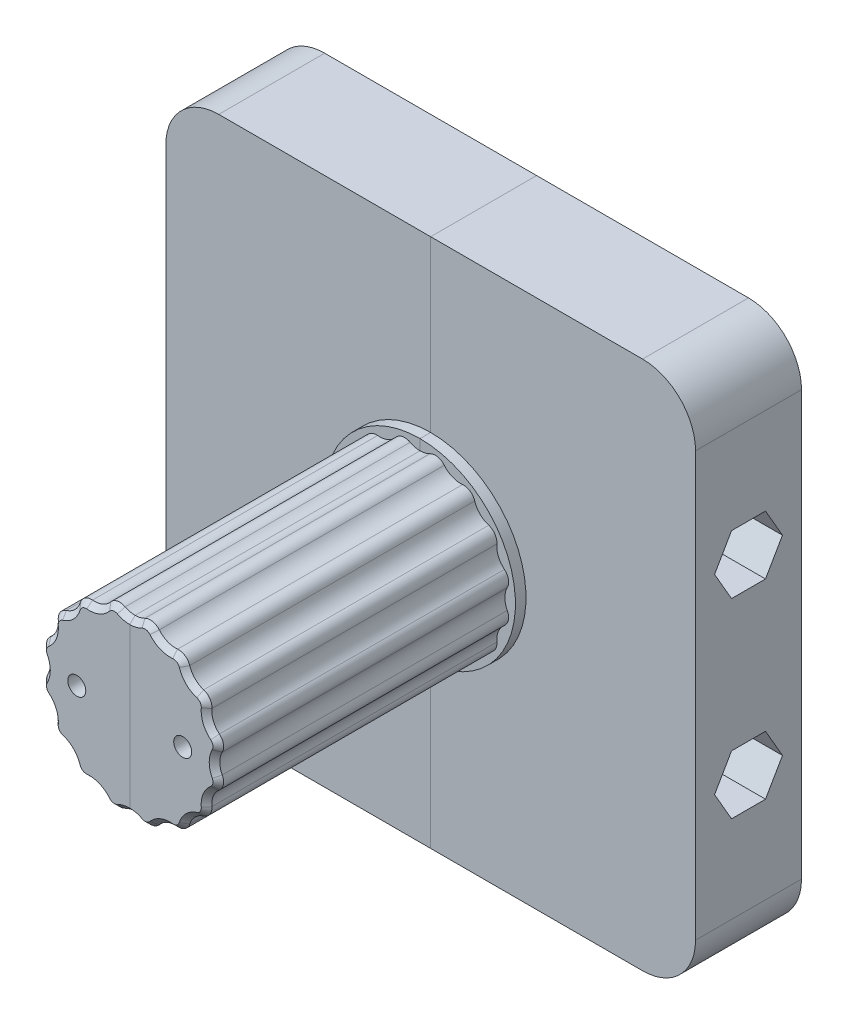
from build123d import *

# Parameters (mm, degrees)
ESQUISSE1_W                           = 50
ESQUISSE1_H                           = 50
BOSS_EXTRU_1_DEPTH                    = 10
ESQUISSE2_R                           = 9
BOSS_EXTRU_2_DEPTH                    = 1
BOSS_EXTRU_3_START                    = 1
ESQUISSE5_R                           = 8.5
BOSS_EXTRU_3_DEPTH                    = 27.4
ESQUISSE16_R                          = 0.85
ENL_V_MAT_EXTRU_9_DEPTH               = 10
ESQUISSE7_R                           = 9.904031252
ENL_V_MAT_EXTRU_2_DEPTH               = 27.4
CHANFREIN1_SIZE                       = 0.5
CONG_1_R                              = 5
ESQUISSE10_R                          = 2.15
ENL_V_MAT_EXTRU_5_DEPTH               = 8
CHANFREIN3_SIZE                       = 1.5
ENL_VEMENT_DE_MATI_RE_BALAYAGE1_PITCH = 1.27
ENL_VEMENT_DE_MATI_RE_BALAYAGE1_TO    = 8
ESQUISSE11_R                          = 2.25
ENL_V_MAT_EXTRU_6_DEPTH               = 5
CHANFREIN2_SIZE                       = 2
CHANFREIN4_SIZE                       = 1
CUT_EXTRUDE3_DEPTH                    = 1
SKETCH5_R                             = 0.9
CUT_EXTRUDE4_DEPTH                    = 3.5
SKETCH5_4_R                           = 1.6
CUT_EXTRUDE6_DEPTH                    = 10
CUT_EXTRUDE7_START                    = -10
SKETCH5_6_R                           = 3
CUT_EXTRUDE7_DEPTH                    = 43.197317939
CUT_EXTRUDE8_START                    = 10
CUT_EXTRUDE8_DEPTH                    = 43.197317939


with BuildPart() as part:
    # Esquisse1 → Boss.-Extru.1 (new body)
    with BuildSketch(Plane.XY):
        Rectangle(ESQUISSE1_W, ESQUISSE1_H)
    extrude(amount=BOSS_EXTRU_1_DEPTH)

    # Esquisse2 → Boss.-Extru.2 (add)
    with BuildSketch(Plane.XY.offset(10)):
        Circle(ESQUISSE2_R)
    extrude(amount=BOSS_EXTRU_2_DEPTH)

    # Esquisse5 → Boss.-Extru.3 (add)
    with BuildSketch(Plane.XY.offset(10).offset(BOSS_EXTRU_3_START)):
        Circle(ESQUISSE5_R)
    extrude(amount=BOSS_EXTRU_3_DEPTH)

    # Esquisse16 → Enlèv. mat.-Extru.9 (cut)
    with BuildSketch(Plane.XY.offset(38.4)):
        with Locations((-5, 0)):
            Circle(ESQUISSE16_R)
        with Locations((5, 0)):
            Circle(ESQUISSE16_R)
    extrude(amount=-ENL_V_MAT_EXTRU_9_DEPTH, mode=Mode.SUBTRACT)

    # Esquisse7 → Enlèv. mat.-Extru.2 (cut)
    with BuildSketch(Plane.XY.offset(38.4)):
        Circle(ESQUISSE7_R)
        with BuildLine():
            ThreePointArc((-0.933317751, 8.231125223), (0, 8), (0.933317751, 8.231125223))
            ThreePointArc((0.933317751, 8.231125223), (1.658267737, 8.336674883), (2.287642085, 7.961733364))
            ThreePointArc((2.287642085, 7.961733364), (3.061467459, 7.39103626), (4.01218842, 7.247402883))
            ThreePointArc((4.01218842, 7.247402883), (4.722346981, 7.067491705), (5.160329152, 6.480239773))
            ThreePointArc((5.160329152, 6.480239773), (5.656854249, 5.656854249), (6.480239773, 5.160329152))
            ThreePointArc((6.480239773, 5.160329152), (7.067491705, 4.722346981), (7.247402883, 4.01218842))
            ThreePointArc((7.247402883, 4.01218842), (7.39103626, 3.061467459), (7.961733364, 2.287642085))
            ThreePointArc((7.961733364, 2.287642085), (8.336674883, 1.658267737), (8.231125223, 0.933317751))
            ThreePointArc((8.231125223, 0.933317751), (8, 0), (8.231125223, -0.933317751))
            ThreePointArc((8.231125223, -0.933317751), (8.336674883, -1.658267737), (7.961733364, -2.287642085))
            ThreePointArc((7.961733364, -2.287642085), (7.39103626, -3.061467459), (7.247402883, -4.01218842))
            ThreePointArc((7.247402883, -4.01218842), (7.067491705, -4.722346981), (6.480239773, -5.160329152))
            ThreePointArc((6.480239773, -5.160329152), (5.656854249, -5.656854249), (5.160329152, -6.480239773))
            ThreePointArc((5.160329152, -6.480239773), (4.722346981, -7.067491705), (4.01218842, -7.247402883))
            ThreePointArc((4.01218842, -7.247402883), (3.061467459, -7.39103626), (2.287642085, -7.961733364))
            ThreePointArc((2.287642085, -7.961733364), (1.658267737, -8.336674883), (0.933317751, -8.231125223))
            ThreePointArc((0.933317751, -8.231125223), (0, -8), (-0.933317751, -8.231125223))
            ThreePointArc((-0.933317751, -8.231125223), (-1.658267737, -8.336674883), (-2.287642085, -7.961733364))
            ThreePointArc((-2.287642085, -7.961733364), (-3.061467459, -7.39103626), (-4.01218842, -7.247402883))
            ThreePointArc((-4.01218842, -7.247402883), (-4.722346981, -7.067491705), (-5.160329152, -6.480239773))
            ThreePointArc((-5.160329152, -6.480239773), (-5.656854249, -5.656854249), (-6.480239773, -5.160329152))
            ThreePointArc((-6.480239773, -5.160329152), (-7.067491705, -4.722346981), (-7.247402883, -4.01218842))
            ThreePointArc((-7.247402883, -4.01218842), (-7.39103626, -3.061467459), (-7.961733364, -2.287642085))
            ThreePointArc((-7.961733364, -2.287642085), (-8.336674883, -1.658267737), (-8.231125223, -0.933317751))
            ThreePointArc((-8.231125223, -0.933317751), (-8, 0), (-8.231125223, 0.933317751))
            ThreePointArc((-8.231125223, 0.933317751), (-8.336674883, 1.658267737), (-7.961733364, 2.287642085))
            ThreePointArc((-7.961733364, 2.287642085), (-7.39103626, 3.061467459), (-7.247402883, 4.01218842))
            ThreePointArc((-7.247402883, 4.01218842), (-7.067491705, 4.722346981), (-6.480239773, 5.160329152))
            ThreePointArc((-6.480239773, 5.160329152), (-5.656854249, 5.656854249), (-5.160329152, 6.480239773))
            ThreePointArc((-5.160329152, 6.480239773), (-4.722346981, 7.067491705), (-4.01218842, 7.247402883))
            ThreePointArc((-4.01218842, 7.247402883), (-3.061467459, 7.39103626), (-2.287642085, 7.961733364))
            ThreePointArc((-2.287642085, 7.961733364), (-1.658267737, 8.336674883), (-0.933317751, 8.231125223))
        make_face(mode=Mode.SUBTRACT)
    extrude(amount=-ENL_V_MAT_EXTRU_2_DEPTH, mode=Mode.SUBTRACT)

    # Chanfrein1
    chanfrein1_edges = [part.edges().sort_by_distance(p)[0] for p in [
        (4.722346981, 7.067491705, 38.4),
        (7.067491705, 4.722346981, 38.4),
        (8.336674883, 1.658267737, 38.4),
        (8.336674883, -1.658267737, 38.4),
        (7.067491705, -4.722346981, 38.4),
        (4.722346981, -7.067491705, 38.4),
        (1.658267737, -8.336674883, 38.4),
        (-1.658267737, -8.336674883, 38.4),
        (-4.722346981, -7.067491705, 38.4),
        (-7.067491705, -4.722346981, 38.4),
        (-8.336674883, -1.658267737, 38.4),
        (-8.336674883, 1.658267737, 38.4),
        (-7.067491705, 4.722346981, 38.4),
        (-4.722346981, 7.067491705, 38.4),
        (-1.658267737, 8.336674883, 38.4),
        (1.658267737, 8.336674883, 38.4),
        (3.061467459, 7.39103626, 38.4),
        (0, 8, 38.4),
        (-3.061467459, 7.39103626, 38.4),
        (-5.656854249, 5.656854249, 38.4),
        (-7.39103626, 3.061467459, 38.4),
        (-8, 0, 38.4),
        (-7.39103626, -3.061467459, 38.4),
        (-5.656854249, -5.656854249, 38.4),
        (-3.061467459, -7.39103626, 38.4),
        (0, -8, 38.4),
        (3.061467459, -7.39103626, 38.4),
        (5.656854249, -5.656854249, 38.4),
        (7.39103626, -3.061467459, 38.4),
        (8, 0, 38.4),
        (7.39103626, 3.061467459, 38.4),
        (5.656854249, 5.656854249, 38.4),
    ]]
    chamfer(chanfrein1_edges, length=CHANFREIN1_SIZE)

    # Congé1
    cong_1_edges = [part.edges().sort_by_distance(p)[0] for p in [
        (25, -25, 5),
        (-25, -25, 5),
        (-25, 25, 5),
        (25, 25, 5),
    ]]
    fillet(cong_1_edges, radius=CONG_1_R)

    # Esquisse10 → Enlèv. mat.-Extru.5 (cut)
    with BuildSketch(Plane(origin=(0, 0, 0), x_dir=(-1, 0, 0), z_dir=(0, 0, -1))):
        Circle(ESQUISSE10_R)
    extrude(amount=-ENL_V_MAT_EXTRU_5_DEPTH, mode=Mode.SUBTRACT)


with BuildPart() as body_2:
    # Fractionner1: read off the stored shape, not the designer's step
    # Fractionner1: the piece on the far side of the plane
    add(part.part)
    split(bisect_by=Plane.XY.offset(8), keep=Keep.BOTTOM)

    # Chanfrein3
    chanfrein3_edges = [body_2.edges().sort_by_distance(p)[0] for p in [
        (2.15, 0, 0),
    ]]
    chamfer(chanfrein3_edges, length=CHANFREIN3_SIZE)

    # Enlèvement de matière-Balayage1: arcs per turn and ends read off the stored shape
    # Enlèvement de matière-Balayage1: the profile of Esquisse14 screwed along a right-hand helix through 8 turns, 8 arcs to a turn; built about Z, then put on its axis
    enl_vement_de_mati_re_balayage1_z = Axis((0, 0, 0), (0, 0, 1))
    enl_vement_de_mati_re_balayage1_corners = [(1.95, 0, -1.616410162), (1.95, 0, 0), (2.35, 0, 0), (2.35, 0, -0.202029946), (3.037407664, 0, -0.598904946), (3.149901509, 0, -0.79375), (3.037407664, 0, -0.988595054)]
    with BuildLine(mode=Mode.PRIVATE) as enl_vement_de_mati_re_balayage1_profile:
        Line(enl_vement_de_mati_re_balayage1_corners[0], enl_vement_de_mati_re_balayage1_corners[1])
        Line(enl_vement_de_mati_re_balayage1_corners[1], enl_vement_de_mati_re_balayage1_corners[2])
        Line(enl_vement_de_mati_re_balayage1_corners[2], enl_vement_de_mati_re_balayage1_corners[3])
        Line(enl_vement_de_mati_re_balayage1_corners[3], enl_vement_de_mati_re_balayage1_corners[4])
        Line(enl_vement_de_mati_re_balayage1_corners[6], enl_vement_de_mati_re_balayage1_corners[0])
        ThreePointArc((3.037407664, 0, -0.598904946), (3.119758874, 0, -0.681256156), (3.149901509, 0, -0.79375))
        ThreePointArc((3.149901509, 0, -0.79375), (3.119758874, 0, -0.906243844), (3.037407664, 0, -0.988595054))
    enl_vement_de_mati_re_balayage1_cap = Face(enl_vement_de_mati_re_balayage1_profile.wire())
    enl_vement_de_mati_re_balayage1_arcs = [((3.037407664, 0, -0.598904946), (3.149901509, 0, -0.663853297), (3.149901509, 0, -0.79375), (1, 0.8660254037844378, 1)), ((3.149901509, 0, -0.79375), (3.149901509, 0, -0.923646703), (3.037407664, 0, -0.988595054), (1, 0.8660254037844378, 1))]  # start, shoulder, end, weights
    enl_vement_de_mati_re_balayage1_turn_angles = [0, 22.5, 45, 67.5, 90, 112.5, 135, 157.5, 180, 202.5, 225, 247.5, 270, 292.5, 315, 337.5, 360]
    enl_vement_de_mati_re_balayage1_turn_weights = [1, 0.9238795325112867, 1, 0.9238795325112867, 1, 0.9238795325112867, 1, 0.9238795325112867, 1, 0.9238795325112867, 1, 0.9238795325112867, 1, 0.9238795325112867, 1, 0.9238795325112867, 1]
    enl_vement_de_mati_re_balayage1_turn_rails = [Edge.make_bspline([Vector(p[0], p[1], 0).rotate(enl_vement_de_mati_re_balayage1_z, enl_vement_de_mati_re_balayage1_turn_angles[k]) / enl_vement_de_mati_re_balayage1_turn_weights[k] + Vector(0, 0, p[2] + ENL_VEMENT_DE_MATI_RE_BALAYAGE1_PITCH * enl_vement_de_mati_re_balayage1_turn_angles[k] / 360) for k in range(17)], [0, 0, 0, 1, 1, 2, 2, 3, 3, 4, 4, 5, 5, 6, 6, 7, 7, 8, 8, 8], 2, enl_vement_de_mati_re_balayage1_turn_weights) for p in enl_vement_de_mati_re_balayage1_corners]
    enl_vement_de_mati_re_balayage1_turn_sides = [*[Face.make_surface_from_curves(enl_vement_de_mati_re_balayage1_turn_rails[p[0]], enl_vement_de_mati_re_balayage1_turn_rails[p[1]]) for p in [(0, 1), (1, 2), (2, 3), (3, 4), (6, 0)]], *[Face.make_bezier_surface([[Vector(p[j][0], p[j][1], 0).rotate(enl_vement_de_mati_re_balayage1_z, enl_vement_de_mati_re_balayage1_turn_angles[2 * i + k]) / enl_vement_de_mati_re_balayage1_turn_weights[2 * i + k] + Vector(0, 0, p[j][2] + ENL_VEMENT_DE_MATI_RE_BALAYAGE1_PITCH * enl_vement_de_mati_re_balayage1_turn_angles[2 * i + k] / 360) for k in range(3)] for j in range(3)], [[p[3][j] * enl_vement_de_mati_re_balayage1_turn_weights[2 * i + k] for k in range(3)] for j in range(3)]) for p in enl_vement_de_mati_re_balayage1_arcs for i in range(8)]]
    enl_vement_de_mati_re_balayage1_turn = Solid(Shell([*enl_vement_de_mati_re_balayage1_turn_sides, enl_vement_de_mati_re_balayage1_cap, enl_vement_de_mati_re_balayage1_cap.rotate(enl_vement_de_mati_re_balayage1_z, 360).moved(Location((0, 0, ENL_VEMENT_DE_MATI_RE_BALAYAGE1_PITCH * 360 / 360)))]))
    enl_vement_de_mati_re_balayage1_each = [*[enl_vement_de_mati_re_balayage1_turn.moved(Location((0, 0, ENL_VEMENT_DE_MATI_RE_BALAYAGE1_PITCH * i))) for i in range(8)]]
    add(Plane(origin=(0, 0, 0), x_dir=(-1, 0, 0), z_dir=(0, 0, 1)) * split(Compound([enl_vement_de_mati_re_balayage1_each[i] for i in range(0, 8, 2)]), bisect_by=Plane.XY.offset(ENL_VEMENT_DE_MATI_RE_BALAYAGE1_TO), keep=Keep.BOTTOM, mode=Mode.PRIVATE), mode=Mode.SUBTRACT)
    add(Plane(origin=(0, 0, 0), x_dir=(-1, 0, 0), z_dir=(0, 0, 1)) * split(Compound([enl_vement_de_mati_re_balayage1_each[i] for i in range(1, 8, 2)]), bisect_by=Plane.XY.offset(ENL_VEMENT_DE_MATI_RE_BALAYAGE1_TO), keep=Keep.BOTTOM, mode=Mode.PRIVATE), mode=Mode.SUBTRACT)


with BuildPart() as part_1:
    add(part.part)

    # Fractionner1
    split(bisect_by=Plane.XY.offset(8), keep=Keep.TOP)


with BuildPart() as body_2_1:
    add(body_2.part)

    # Combiner1: union part
    add(part_1.part)

    # Esquisse11 → Enlèv. mat.-Extru.6 (cut)
    with BuildSketch(Plane(origin=(0, 0, 0), x_dir=(-1, 0, 0), z_dir=(0, 0, -1))):
        with Locations((0, 14)):
            Circle(ESQUISSE11_R)
    extrude(amount=-ENL_V_MAT_EXTRU_6_DEPTH, mode=Mode.SUBTRACT)

    # Chanfrein2
    chanfrein2_edges = [body_2_1.edges().sort_by_distance(p)[0] for p in [
        (2.25, 14, 5),
    ]]
    chamfer(chanfrein2_edges, length=CHANFREIN2_SIZE)

    # Chanfrein4
    chanfrein4_edges = [body_2_1.edges().sort_by_distance(p)[0] for p in [
        (2.25, 14, 0),
    ]]
    chamfer(chanfrein4_edges, length=CHANFREIN4_SIZE)

    # Sketch4 → Cut-Extrude3 (cut)
    with BuildSketch(Plane(origin=(0, 0, 0), x_dir=(-1, 0, 0), z_dir=(0, 0, -1))):
        with BuildLine():
            Line((-4, -9), (4, -9))
            ThreePointArc((4, -9), (7.535533906, -7.535533906), (9, -4))
            Line((9, -4), (9, 4))
            ThreePointArc((9, 4), (7.535533906, 7.535533906), (4, 9))
            Line((4, 9), (-4, 9))
            ThreePointArc((-4, 9), (-7.535533906, 7.535533906), (-9, 4))
            Line((-9, 4), (-9, -4))
            ThreePointArc((-9, -4), (-7.535533906, -7.535533906), (-4, -9))
        make_face()
    extrude(amount=-CUT_EXTRUDE3_DEPTH, mode=Mode.SUBTRACT)

    # Sketch5 → Cut-Extrude4 (cut, symmetric)
    with BuildSketch(Plane(origin=(0, 0, 0), x_dir=(0, 0, -1), z_dir=(1, 0, 0))):
        with Locations((-33.9, 0)):
            Circle(SKETCH5_R)
        with Locations((-18.9, 0)):
            Circle(SKETCH5_R)
    extrude(amount=CUT_EXTRUDE4_DEPTH, both=True, mode=Mode.SUBTRACT)

    # Sketch5<4> → Cut-Extrude6 (cut, symmetric)
    with BuildSketch(Plane(origin=(0, 0, 0), x_dir=(0, 0, -1), z_dir=(1, 0, 0))):
        with Locations((-5, 9)):
            Circle(SKETCH5_4_R)
        with Locations((-5, -9)):
            Circle(SKETCH5_4_R)
    extrude(amount=CUT_EXTRUDE6_DEPTH, both=True, mode=Mode.SUBTRACT)

    # Sketch5<6> → Cut-Extrude7 (cut, through all)
    with BuildSketch(Plane(origin=(0, 0, 0), x_dir=(0, 0, -1), z_dir=(1, 0, 0)).offset(CUT_EXTRUDE7_START)):
        with Locations((-5, 9)):
            Circle(SKETCH5_6_R)
        with Locations((-5, -9)):
            Circle(SKETCH5_6_R)
    extrude(amount=-CUT_EXTRUDE7_DEPTH, mode=Mode.SUBTRACT)

    # Sketch5<9> → Cut-Extrude8 (cut, through all)
    with BuildSketch(Plane(origin=(0, 0, 0), x_dir=(0, 0, -1), z_dir=(1, 0, 0)).offset(CUT_EXTRUDE8_START)):
        Polygon((-8.204293994, 9), (-6.602146997, 6.225), (-3.397853003, 6.225), (-1.795706006, 9), (-3.397853003, 11.775), (-6.602146997, 11.775), align=None)
        Polygon((-8.204293994, -9), (-6.602146997, -11.775), (-3.397853003, -11.775), (-1.795706006, -9), (-3.397853003, -6.225), (-6.602146997, -6.225), align=None)
    extrude(amount=CUT_EXTRUDE8_DEPTH, mode=Mode.SUBTRACT)


with BuildPart() as body_2_2:
    # Split1: the piece on the far side of the plane
    add(body_2_1.part)
    split(bisect_by=Plane(origin=(0, 0, 0), x_dir=(0, 0, 1), z_dir=(1, 0, 0)), keep=Keep.BOTTOM)


with BuildPart() as body_2_3:
    add(body_2_1.part)

    # Split1
    split(bisect_by=Plane(origin=(0, 0, 0), x_dir=(0, 0, 1), z_dir=(1, 0, 0)), keep=Keep.TOP)


solid = Compound([body_2_2.part, body_2_3.part])
